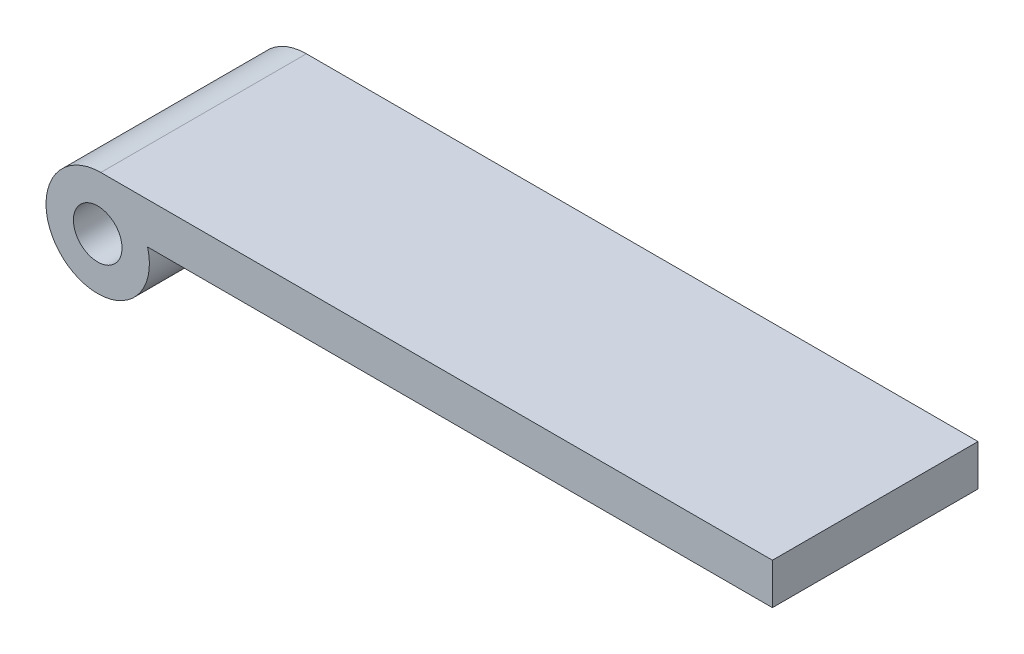
from build123d import *

# Parameters (mm, degrees)
SKETCH1_W           = 33.655
SKETCH1_H           = 9.525
BOSS_EXTRUDE1_DEPTH = 5.08
SKETCH4_R           = 1.125
CUT_EXTRUDE2_DEPTH  = 20.992418094
FILLET1_R           = 2.54
CUT_EXTRUDE3_DEPTH  = 20.992418094


with BuildPart() as part:
    # Sketch1 → Boss-Extrude1 (new body)
    with BuildSketch(Plane(origin=(0, 0, 0), x_dir=(1, 0, 0), z_dir=(0, 1, 0))):
        Rectangle(SKETCH1_W, SKETCH1_H)
    extrude(amount=BOSS_EXTRUDE1_DEPTH)

    # Sketch4 → Cut-Extrude2 (cut, through all)
    with BuildSketch(Plane.XY.offset(4.7625)):
        with Locations((-14.4325, 2.54)):
            Circle(SKETCH4_R)
    extrude(amount=-CUT_EXTRUDE2_DEPTH, mode=Mode.SUBTRACT)

    # Fillet1
    fillet1_edges = [part.edges().sort_by_distance(p)[0] for p in [
        (-16.8275, 0, 0),
        (-16.8275, 5.08, 0),
    ]]
    fillet(fillet1_edges, radius=FILLET1_R - 0.0001)  # a hair under: the kernel refuses the full size

    # Sketch5 → Cut-Extrude3 (cut, through all)
    with BuildSketch(Plane.XY.offset(4.7625)):
        with BuildLine():
            Line((16.8275, 0), (16.8275, 3.175))
            Line((16.8275, 3.175), (-12.123214396, 3.175))
            ThreePointArc((-12.123214396, 3.175), (-12.05902533, 2.860379446), (-12.0375, 2.54))
            ThreePointArc((-12.0375, 2.54), (-14.4325, 0.145), (-16.8275, 2.54))
            ThreePointArc((-16.8275, 2.54), (-16.083551224, 0.743948776), (-14.2875, 0))
            Line((-14.2875, 0), (16.8275, 0))
        make_face()
    extrude(amount=-CUT_EXTRUDE3_DEPTH, mode=Mode.SUBTRACT)


with BuildPart() as cut_extrude3_kept_piece:
    # of the separate pieces the step leaves, the one the design keeps (cut_extrude3_pieces_kept)
    add(part.part.solids().sort_by_distance((-16.8275, 2.5401, -4.7625))[0])


solid = cut_extrude3_kept_piece.part
